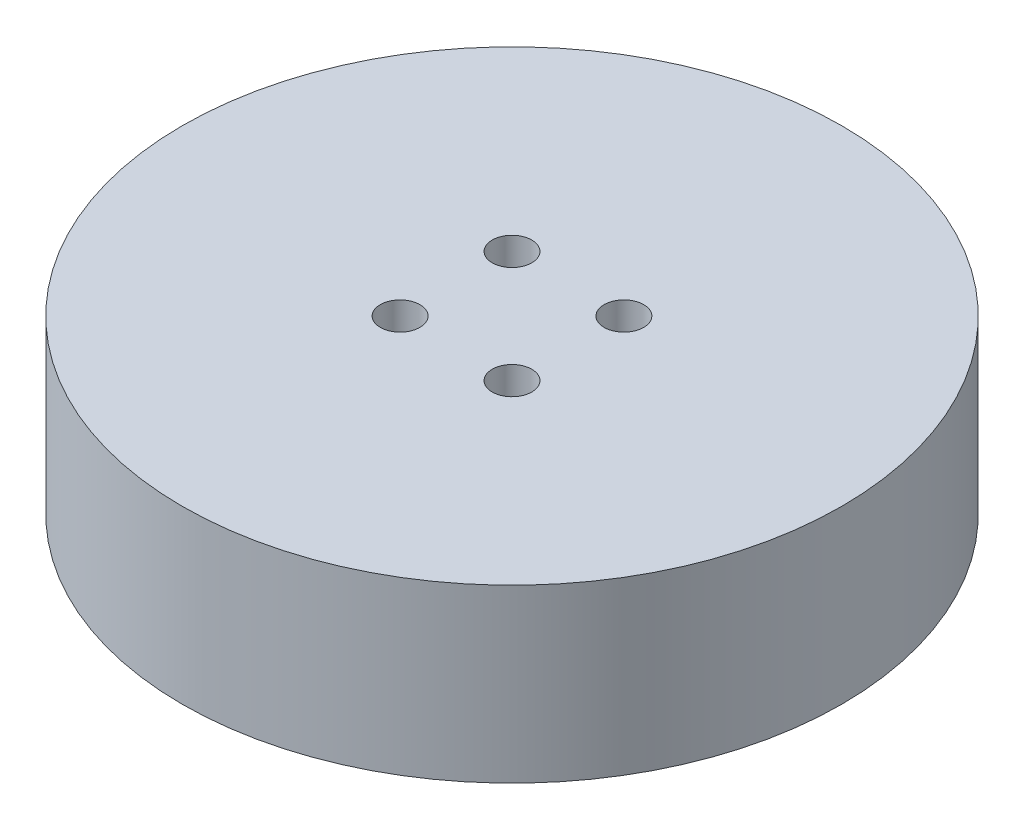
from build123d import *

# Parameters (mm, degrees)
SKETCH1_R           = 25
BOSS_EXTRUDE1_DEPTH = 13
SKETCH2_R           = 12.5
BOSS_EXTRUDE2_DEPTH = 7
SKETCH3_R           = 1.5
CUT_EXTRUDE1_DEPTH  = 10
SKETCH4_R           = 1.5
CUT_EXTRUDE2_DEPTH  = 5


# Read off the part's stored shape, not the designer's step: Split1
with BuildPart() as part:
    # Sketch1 → Boss-Extrude1 (new body)
    with BuildSketch(Plane(origin=(0, 0, 0), x_dir=(1, 0, 0), z_dir=(0, 1, 0))):
        with Locations(Location((0, 0, 0), (0, 0, 90))):
            Circle(SKETCH1_R)
    extrude(amount=BOSS_EXTRUDE1_DEPTH)

    # Sketch2 → Boss-Extrude2 (add)
    with BuildSketch(Plane.XZ):
        with Locations(Location((0, 0, 0), (0, 0, 270))):
            Circle(SKETCH2_R)
    extrude(amount=BOSS_EXTRUDE2_DEPTH)

    # Sketch3 → Cut-Extrude1 (cut)
    with BuildSketch(Plane(origin=(0, 13, 0), x_dir=(1, 0, 0), z_dir=(0, 1, 0))):
        with Locations(Location((-4.242640687, 4.242640687, 0), (0, 0, 270))):
            Circle(SKETCH3_R)
        with Locations(Location((4.242640687, 4.242640687, 0), (0, 0, 270))):
            Circle(SKETCH3_R)
        with Locations(Location((4.242640687, -4.242640687, 0), (0, 0, 270))):
            Circle(SKETCH3_R)
        with Locations(Location((-4.242640687, -4.242640687, 0), (0, 0, 270))):
            Circle(SKETCH3_R)
    extrude(amount=-CUT_EXTRUDE1_DEPTH, mode=Mode.SUBTRACT)

    # Sketch4 → Cut-Extrude2 (cut)
    with BuildSketch(Plane.XZ.offset(7)):
        with Locations(Location((9.5, 0, 0), (0, 0, 270))):
            Circle(SKETCH4_R)
        with Locations(Location((-9.5, 0, 0), (0, 0, 270))):
            Circle(SKETCH4_R)
        with Locations(Location((0, 8, 0), (0, 0, 270))):
            Circle(SKETCH4_R)
        with Locations(Location((0, -8, 0), (0, 0, 270))):
            Circle(SKETCH4_R)
    extrude(amount=-CUT_EXTRUDE2_DEPTH, mode=Mode.SUBTRACT)


with BuildPart() as body_2:
    # Split1: the piece on the far side of the plane
    add(part.part)
    split(bisect_by=Plane(origin=(0, 0, 0), x_dir=(1, 0, 0), z_dir=(0, 1, 0)), keep=Keep.BOTTOM)


with BuildPart() as part_1:
    add(part.part)

    # Split1
    split(bisect_by=Plane(origin=(0, 0, 0), x_dir=(1, 0, 0), z_dir=(0, 1, 0)), keep=Keep.TOP)


solid = Compound([body_2.part, part_1.part])
